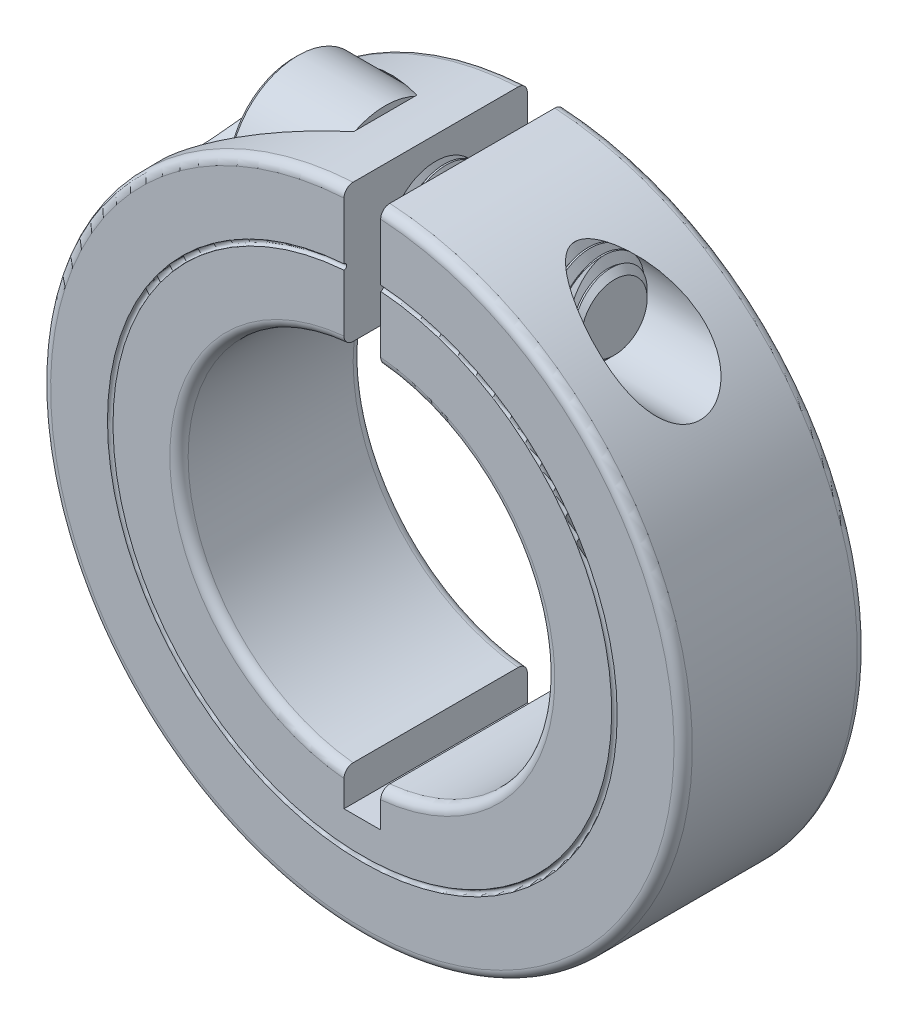
from build123d import *

# Parameters (mm, degrees)
EXTRUDE1_DEPTH     = 6.35
FILLET1_R          = 0.635
CUT_EXTRUDE1_DEPTH = 4.7625
CHAMFER1_SIZE      = 0.3175
CHAMFER2_SIZE      = 0.907142857
CUT_SWEEP1_PITCH   = 0.907142857


with BuildPart() as part:
    # Sketch1 → Extrude1 (new, symmetric)
    with BuildSketch(Plane.XY):
        with BuildLine():
            Line((-1.27, 12.636340451), (-1.27, 22.188684616))
            ThreePointArc((-1.27, 22.188684616), (0, -22.225), (1.27, 22.188684616))
            Line((1.27, 22.188684616), (1.27, 12.636340451))
            ThreePointArc((1.27, 12.636340451), (12.7, 0), (1.27, -12.636340451))
            Line((1.27, -12.636340451), (1.27, -15.08125))
            Line((1.27, -15.08125), (-1.27, -15.08125))
            Line((-1.27, -15.08125), (-1.27, -12.636340451))
            ThreePointArc((-1.27, -12.636340451), (-12.7, 0), (-1.27, 12.636340451))
        make_face()
    extrude(amount=EXTRUDE1_DEPTH, both=True)

    # Fillet1
    fillet1_edges = [part.edges().sort_by_distance(p)[0] for p in [
        (-12.7, 0, 6.35),
        (0, -22.225, 6.35),
        (12.7, 0, 6.35),
        (12.7, 0, -6.35),
        (0, -22.225, -6.35),
        (-12.7, 0, -6.35),
    ]]
    fillet(fillet1_edges, radius=FILLET1_R)

    # Sketch2 → Cut-Revolve1 (revolve, cut)
    with BuildSketch(Plane(origin=(0, 0, 0), x_dir=(1, 0, 0), z_dir=(0, 1, 0))):
        with BuildLine():
            Line((-17.653, -6.35), (-17.272, -6.35))
            ThreePointArc((-17.272, -6.35), (-17.4625, -6.1595), (-17.653, -6.35))
        make_face()
    revolve(axis=Axis((0, 0, -6.35), (0, 0, 1)), mode=Mode.SUBTRACT)

    # Sketch3 → Cut-Revolve2 (revolve, cut)
    with BuildSketch(Plane.XY, mode=Mode.PRIVATE) as cut_revolve2_sk:
        Polygon((22.225, 17.412512534), (-22.225, 17.412512534), (-22.225, 12.586512534), (-4.7625, 12.586512534), (-4.7625, 14.237512534), (22.225, 14.237512534), align=None)
    revolve(cut_revolve2_sk.sketch.rotate(Axis((-22.225, 17.412512534, 0), (-1, 0, 0)), 270), axis=Axis((-22.225, 17.412512534, 0), (-1, 0, 0)), mode=Mode.SUBTRACT)


with BuildPart() as body_2:
    # Sketch4 → Revolve1 (revolve)
    with BuildSketch(Plane.XY):
        Polygon((-11.1125, 17.412512534), (-11.1125, 22.175012534), (-4.7625, 22.175012534), (-4.7625, 20.587512534), (11.1125, 20.587512534), (11.1125, 17.412512534), align=None)
    revolve(axis=Axis((11.1125, 17.412512534, 0), (-1, 0, 0)))

    # Sketch5 → Cut-Extrude1 (cut)
    with BuildSketch(Plane(origin=(-11.1125, 0, 0), x_dir=(0, -1, 0), z_dir=(-1, 0, 0))):
        Polygon((-16.037697205, -2.38125), (-14.662881877, 0), (-16.037697205, 2.38125), (-18.787327862, 2.38125), (-20.162143191, 0), (-18.787327862, -2.38125), align=None)
    extrude(amount=-CUT_EXTRUDE1_DEPTH, mode=Mode.SUBTRACT)

    # Chamfer1
    chamfer1_edges = [body_2.edges().sort_by_distance(p)[0] for p in [
        (-11.1125, 12.650012534, 0),
    ]]
    chamfer(chamfer1_edges, length=CHAMFER1_SIZE)

    # Chamfer2
    chamfer2_edges = [body_2.edges().sort_by_distance(p)[0] for p in [
        (11.1125, 14.237512534, 0),
    ]]
    chamfer(chamfer2_edges, length=CHAMFER2_SIZE)

    # Cut-Sweep1: arcs per turn and ends read off the stored shape
    # Cut-Sweep1: the profile of Sketch7 screwed along a right-hand helix through 17.5 turns, 8 arcs to a turn; built about Z, then put on its axis
    cut_sweep1_z = Axis((0, 0, 0), (0, 0, 1))
    cut_sweep1_corners = [(2.585793431, -4.51e-07, -0.566964311), (2.585793431, -4.51e-07, -0.680357168), (3.224100547, -5.63e-07, -1.048883954), (3.224100547, -5.63e-07, -0.198437525)]
    with BuildLine(mode=Mode.PRIVATE) as cut_sweep1_profile:
        Line(cut_sweep1_corners[0], cut_sweep1_corners[1])
        Line(cut_sweep1_corners[1], cut_sweep1_corners[2])
        Line(cut_sweep1_corners[2], cut_sweep1_corners[3])
        Line(cut_sweep1_corners[3], cut_sweep1_corners[0])
    cut_sweep1_cap = Face(cut_sweep1_profile.wire())
    cut_sweep1_turn_angles = [0, 22.5, 45, 67.5, 90, 112.5, 135, 157.5, 180, 202.5, 225, 247.5, 270, 292.5, 315, 337.5, 360]
    cut_sweep1_turn_weights = [1, 0.9238795325112867, 1, 0.9238795325112867, 1, 0.9238795325112867, 1, 0.9238795325112867, 1, 0.9238795325112867, 1, 0.9238795325112867, 1, 0.9238795325112867, 1, 0.9238795325112867, 1]
    cut_sweep1_turn_rails = [Edge.make_bspline([Vector(p[0], p[1], 0).rotate(cut_sweep1_z, cut_sweep1_turn_angles[k]) / cut_sweep1_turn_weights[k] + Vector(0, 0, p[2] + CUT_SWEEP1_PITCH * cut_sweep1_turn_angles[k] / 360) for k in range(17)], [0, 0, 0, 1, 1, 2, 2, 3, 3, 4, 4, 5, 5, 6, 6, 7, 7, 8, 8, 8], 2, cut_sweep1_turn_weights) for p in cut_sweep1_corners]
    cut_sweep1_turn_sides = [Face.make_surface_from_curves(cut_sweep1_turn_rails[p[0]], cut_sweep1_turn_rails[p[1]]) for p in [(0, 1), (1, 2), (2, 3), (3, 0)]]
    cut_sweep1_last_angles = [6120, 6142.5, 6165, 6187.5, 6210, 6232.5, 6255, 6277.5, 6300]
    cut_sweep1_last_weights = [1, 0.9238795325112867, 1, 0.9238795325112867, 1, 0.9238795325112867, 1, 0.923879532511141, 1]
    cut_sweep1_last_rails = [Edge.make_bspline([Vector(p[0], p[1], 0).rotate(cut_sweep1_z, cut_sweep1_last_angles[k]) / cut_sweep1_last_weights[k] + Vector(0, 0, p[2] + CUT_SWEEP1_PITCH * cut_sweep1_last_angles[k] / 360) for k in range(9)], [0, 0, 0, 1, 1, 2, 2, 3, 3, 4, 4, 4], 2, cut_sweep1_last_weights) for p in cut_sweep1_corners]
    cut_sweep1_last_sides = [Face.make_surface_from_curves(cut_sweep1_last_rails[p[0]], cut_sweep1_last_rails[p[1]]) for p in [(0, 1), (1, 2), (2, 3), (3, 0)]]
    cut_sweep1 = Plane(origin=(11.1125, 17.412512534, 0), x_dir=(0, 0, 1), z_dir=(-1, 0, 0)) * Solid(Shell([*[p.moved(Location((0, 0, CUT_SWEEP1_PITCH * i))) for i in range(17) for p in cut_sweep1_turn_sides], *cut_sweep1_last_sides, cut_sweep1_cap, cut_sweep1_cap.rotate(cut_sweep1_z, 6300).moved(Location((0, 0, CUT_SWEEP1_PITCH * 6300 / 360)))]))
    add(cut_sweep1, mode=Mode.SUBTRACT)


solid = Compound([part.part, body_2.part])
